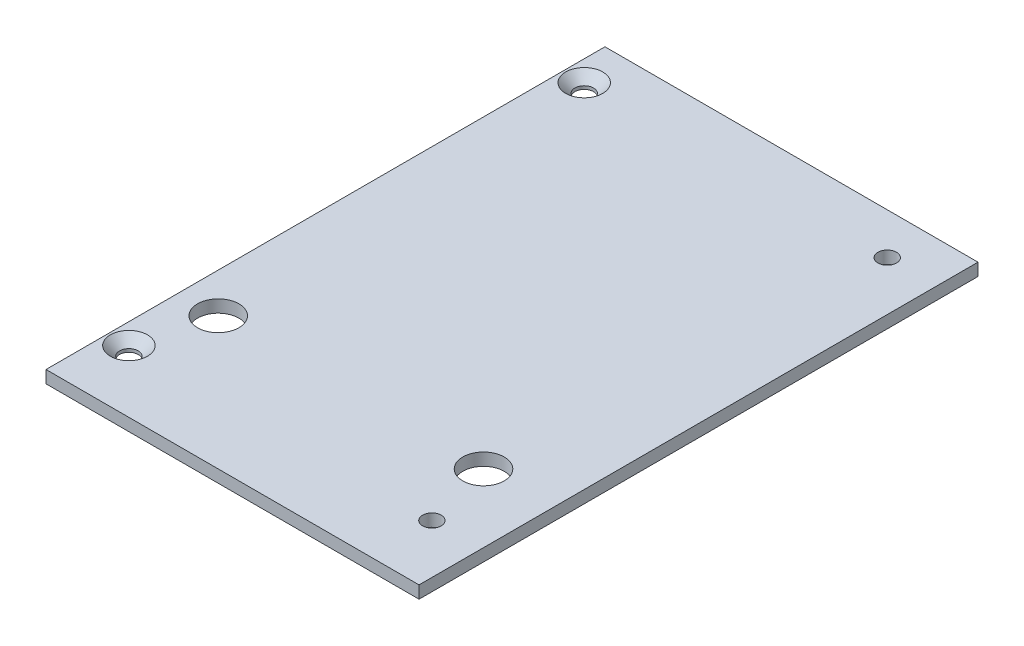
from build123d import *

# Parameters (mm, degrees)
SKETCH1_W                                            = 90
SKETCH1_H                                            = 134.85
SKETCH1_R                                            = 2.25
BOSS_EXTRUDE1_DEPTH                                  = 3
SKETCH2_R                                            = 5
CUT_EXTRUDE1_DEPTH                                   = 10
BOSS_EXTRUDE2_DEPTH                                  = 3
FILLET1_R                                            = 10
AVELLANADO_PARA_TORNILLO_TAP_N_AVELLANAD_D           = 4.5
AVELLANADO_PARA_TORNILLO_TAP_N_AVELLANAD_DEPTH       = 6
AVELLANADO_PARA_TORNILLO_TAP_N_AVELLANAD_CSINK_D     = 8.96
AVELLANADO_PARA_TORNILLO_TAP_N_AVELLANAD_CSINK_ANGLE = 90
AVELLANADO_PARA_TORNILLO_TAP_N_AVELLANAD_TIP         = 1.351936393


with BuildPart() as part:
    # Sketch1 → Boss-Extrude1 (new body)
    with BuildSketch(Plane(origin=(0, 0, 0), x_dir=(1, 0, 0), z_dir=(0, 1, 0))):
        Rectangle(SKETCH1_W, SKETCH1_H)
        with Locations(Location((-40, 57.425, 0), (0, 0, 270))):
            Circle(SKETCH1_R, mode=Mode.SUBTRACT)
        with Locations(Location((33.1, 57.425, 0), (0, 0, 270))):
            Circle(SKETCH1_R, mode=Mode.SUBTRACT)
        with Locations(Location((33.1, -52.425, 0), (0, 0, 270))):
            Circle(SKETCH1_R, mode=Mode.SUBTRACT)
        with Locations(Location((-40, -52.425, 0), (0, 0, 270))):
            Circle(SKETCH1_R, mode=Mode.SUBTRACT)
    extrude(amount=BOSS_EXTRUDE1_DEPTH)

    # Sketch2 → Cut-Extrude1 (cut)
    with BuildSketch(Plane.XZ):
        with Locations(Location((-35.45, 35.425, 0), (0, 0, 270))):
            Circle(SKETCH2_R)
        with Locations(Location((28.55, 35.425, 0), (0, 0, 270))):
            Circle(SKETCH2_R)
    extrude(amount=-CUT_EXTRUDE1_DEPTH, mode=Mode.SUBTRACT)

    # Sketch3 → Boss-Extrude2 (add)
    with BuildSketch(Plane.XZ):
        with BuildLine():
            Line((-34.6, -0.380630602), (-34.6, -67.025))
            Line((-34.6, -67.025), (27.7, -67.025))
            Line((27.7, -67.025), (27.7, -0.380630602))
            ThreePointArc((27.7, -0.380630602), (27.519005613, 0.897019347), (26.990265482, 2.074126918))
            Line((26.990265482, 2.074126918), (0.440265482, 44.150196648))
            ThreePointArc((0.440265482, 44.150196648), (-3.45, 46.295439129), (-7.340265482, 44.150196648))
            Line((-7.340265482, 44.150196648), (-33.890265482, 2.074126918))
            ThreePointArc((-33.890265482, 2.074126918), (-34.419005613, 0.897019347), (-34.6, -0.380630602))
        make_face()
        Polygon((-29.6, -0.49628105), (-29.6, -62.025), (22.7, -62.025), (22.7, -0.49628105), (-3.45, 40.945874259), align=None, mode=Mode.SUBTRACT)
    extrude(amount=BOSS_EXTRUDE2_DEPTH)

    # Fillet1
    # the kernel refuses this fillet: 10 mm, written as the material it adds along each edge
    with BuildSketch(Plane(origin=(32.227432138, 0, -15.595222631), x_dir=(0, -1, 0), z_dir=(-0.5336429389662942, 0, 0.8457098874267795))) as fillet1_piece_1_section:
        with BuildLine():
            CenterArc((10, -7.141428429), FILLET1_R, 134.427004001, 45.572995999)
            Line((0, -7.141428429), (-0.2, -7.141428429))
            Line((-0.2, -7.141428429), (-0.2, 0))
            Line((-0.2, 0), (0, 0.2))
            ThreePointArc((0, 0.2), (1.5, 0.2), (2.86, 0.142828569))
            Line((2.86, 0.142828569), (3, 0))
        make_face()
    fillet1_piece_1 = extrude(amount=84.709945498, mode=Mode.PRIVATE)
    fillet1_piece_1 = split(fillet1_piece_1, bisect_by=Plane(origin=(-18.807365912, 0, 16.607734938), z_dir=(0.8457098874267777, 0, -0.533642938966297)), keep=Keep.TOP, mode=Mode.PRIVATE)
    fillet1_piece_1 = split(fillet1_piece_1, bisect_by=Plane(origin=(22.7, 0, -15.595222631), z_dir=(-1, 0, 0)), keep=Keep.TOP, mode=Mode.PRIVATE)
    add(fillet1_piece_1)
    with BuildSketch(Plane(origin=(22.7, 0, -62.025), x_dir=(0, -1, 0), z_dir=(0, 0, 1))) as fillet1_piece_2_section:
        with BuildLine():
            CenterArc((10, -7.141428429), FILLET1_R, 134.427004001, 45.572995999)
            Line((0, -7.141428429), (-0.2, -7.141428429))
            Line((-0.2, -7.141428429), (-0.2, 0))
            Line((-0.2, 0), (0, 0.2))
            ThreePointArc((0, 0.2), (1.5, 0.2), (2.86, 0.142828569))
            Line((2.86, 0.142828569), (3, 0))
        make_face()
    fillet1_piece_2 = extrude(amount=79.382290022, mode=Mode.PRIVATE)
    fillet1_piece_2 = split(fillet1_piece_2, bisect_by=Plane(origin=(50.468348322, 0, -44.503172209), z_dir=(-0.8457098874267795, 0, -0.5336429389662942)), keep=Keep.TOP, mode=Mode.PRIVATE)
    add(fillet1_piece_2)
    with BuildSketch(Plane(origin=(-29.6, 0, -62.025), x_dir=(0, -1, 0), z_dir=(1, 0, 0))) as fillet1_piece_3:
        with BuildLine():
            CenterArc((10, -7.141428429), FILLET1_R, 134.427004001, 45.572995999)
            Line((0, -7.141428429), (-0.2, -7.141428429))
            Line((-0.2, -7.141428429), (-0.2, 0))
            Line((-0.2, 0), (0, 0.2))
            ThreePointArc((0, 0.2), (1.5, 0.2), (2.86, 0.142828569))
            Line((2.86, 0.142828569), (3, 0))
        make_face()
    extrude(amount=52.3)
    with BuildSketch(Plane(origin=(-29.6, 0, 17.357290022), x_dir=(0, -1, 0), z_dir=(0, 0, -1))) as fillet1_piece_4_section:
        with BuildLine():
            CenterArc((10, -7.141428429), FILLET1_R, 134.427004001, 45.572995999)
            Line((0, -7.141428429), (-0.2, -7.141428429))
            Line((-0.2, -7.141428429), (-0.2, 0))
            Line((-0.2, 0), (0, 0.2))
            ThreePointArc((0, 0.2), (1.5, 0.2), (2.86, 0.142828569))
            Line((2.86, 0.142828569), (3, 0))
        make_face()
    fillet1_piece_4 = extrude(amount=79.382290022, mode=Mode.PRIVATE)
    fillet1_piece_4 = split(fillet1_piece_4, bisect_by=Plane(origin=(-21.542556439, 0, 12.273043135), z_dir=(0.8457098874267777, 0, -0.533642938966297)), keep=Keep.TOP, mode=Mode.PRIVATE)
    add(fillet1_piece_4)
    with BuildSketch(Plane(origin=(6.077432138, 0, 56.04481584), x_dir=(0, -1, 0), z_dir=(-0.5336429389662971, 0, -0.8457098874267778))) as fillet1_piece_5_section:
        with BuildLine():
            CenterArc((10, -7.141428429), FILLET1_R, 134.427004001, 45.572995999)
            Line((0, -7.141428429), (-0.2, -7.141428429))
            Line((-0.2, -7.141428429), (-0.2, 0))
            Line((-0.2, 0), (0, 0.2))
            ThreePointArc((0, 0.2), (1.5, 0.2), (2.86, 0.142828569))
            Line((2.86, 0.142828569), (3, 0))
        make_face()
    fillet1_piece_5 = extrude(amount=84.709945498, mode=Mode.PRIVATE)
    fillet1_piece_5 = split(fillet1_piece_5, bisect_by=Plane(origin=(-7.551087235, 0, 47.445220116), z_dir=(-0.8457098874267795, 0, -0.5336429389662942)), keep=Keep.TOP, mode=Mode.PRIVATE)
    fillet1_piece_5 = split(fillet1_piece_5, bisect_by=Plane(origin=(-29.6, 0, 56.04481584), z_dir=(1, 0, 0)), keep=Keep.TOP, mode=Mode.PRIVATE)
    add(fillet1_piece_5)
    with BuildSketch(Plane(origin=(32.227432138, 0, -15.595222631), x_dir=(0, -1, 0), z_dir=(-0.5336429389662942, 0, 0.8457098874267795))) as fillet1_piece_6a_section:
        with BuildLine():
            CenterArc((10, -7.141428429), FILLET1_R, 134.427004001, 45.572995999)
            Line((0, -7.141428429), (-0.2, -7.141428429))
            Line((-0.2, -7.141428429), (-0.2, 0))
            Line((-0.2, 0), (0, 0.2))
            ThreePointArc((0, 0.2), (1.5, 0.2), (2.86, 0.142828569))
            Line((2.86, 0.142828569), (3, 0))
        make_face()
    fillet1_piece_6a = extrude(amount=84.709945498, mode=Mode.PRIVATE)
    fillet1_piece_6a = split(fillet1_piece_6a, bisect_by=Plane(origin=(22.7, 0, -15.595222631), z_dir=(1, 0, 0)), keep=Keep.TOP, mode=Mode.PRIVATE)
    with BuildSketch(Plane(origin=(22.7, 0, -62.025), x_dir=(0, -1, 0), z_dir=(0, 0, 1))) as fillet1_piece_6b_section:
        with BuildLine():
            CenterArc((10, -7.141428429), FILLET1_R, 134.427004001, 45.572995999)
            Line((0, -7.141428429), (-0.2, -7.141428429))
            Line((-0.2, -7.141428429), (-0.2, 0))
            Line((-0.2, 0), (0, 0.2))
            ThreePointArc((0, 0.2), (1.5, 0.2), (2.86, 0.142828569))
            Line((2.86, 0.142828569), (3, 0))
        make_face()
    fillet1_piece_6b = extrude(amount=79.382290022, mode=Mode.PRIVATE)
    fillet1_piece_6b = split(fillet1_piece_6b, bisect_by=Plane(origin=(50.468348322, 0, -44.503172209), z_dir=(0.8457098874267795, 0, 0.5336429389662942)), keep=Keep.TOP, mode=Mode.PRIVATE)
    fillet1_piece_6 = fillet1_piece_6a & fillet1_piece_6b
    add(fillet1_piece_6)
    with BuildSketch(Plane(origin=(6.077432138, 0, 56.04481584), x_dir=(0, -1, 0), z_dir=(-0.5336429389662971, 0, -0.8457098874267778))) as fillet1_piece_7a_section:
        with BuildLine():
            CenterArc((10, -7.141428429), FILLET1_R, 134.427004001, 45.572995999)
            Line((0, -7.141428429), (-0.2, -7.141428429))
            Line((-0.2, -7.141428429), (-0.2, 0))
            Line((-0.2, 0), (0, 0.2))
            ThreePointArc((0, 0.2), (1.5, 0.2), (2.86, 0.142828569))
            Line((2.86, 0.142828569), (3, 0))
        make_face()
    fillet1_piece_7a = extrude(amount=84.709945498, mode=Mode.PRIVATE)
    fillet1_piece_7a = split(fillet1_piece_7a, bisect_by=Plane(origin=(-7.551087235, 0, 47.445220116), z_dir=(0.8457098874267795, 0, 0.5336429389662942)), keep=Keep.TOP, mode=Mode.PRIVATE)
    with BuildSketch(Plane(origin=(32.227432138, 0, -15.595222631), x_dir=(0, -1, 0), z_dir=(-0.5336429389662942, 0, 0.8457098874267795))) as fillet1_piece_7b_section:
        with BuildLine():
            CenterArc((10, -7.141428429), FILLET1_R, 134.427004001, 45.572995999)
            Line((0, -7.141428429), (-0.2, -7.141428429))
            Line((-0.2, -7.141428429), (-0.2, 0))
            Line((-0.2, 0), (0, 0.2))
            ThreePointArc((0, 0.2), (1.5, 0.2), (2.86, 0.142828569))
            Line((2.86, 0.142828569), (3, 0))
        make_face()
    fillet1_piece_7b = extrude(amount=84.709945498, mode=Mode.PRIVATE)
    fillet1_piece_7b = split(fillet1_piece_7b, bisect_by=Plane(origin=(-18.807365912, 0, 16.607734938), z_dir=(-0.8457098874267777, 0, 0.533642938966297)), keep=Keep.TOP, mode=Mode.PRIVATE)
    fillet1_piece_7 = fillet1_piece_7a & fillet1_piece_7b
    add(fillet1_piece_7)
    with BuildSketch(Plane(origin=(22.7, 0, -79.878571071), x_dir=(0, -1, 0), z_dir=(0, 0, 1))) as fillet1_piece_8a_section:
        with BuildLine():
            CenterArc((10, -7.141428429), FILLET1_R, 134.427004001, 45.572995999)
            Line((0, -7.141428429), (-0.2, -7.141428429))
            Line((-0.2, -7.141428429), (-0.2, 0))
            Line((-0.2, 0), (0, 0.2))
            ThreePointArc((0, 0.2), (1.5, 0.2), (2.86, 0.142828569))
            Line((2.86, 0.142828569), (3, 0))
        make_face()
    fillet1_piece_8a = extrude(amount=97.235861093, mode=Mode.PRIVATE)
    fillet1_piece_8a = split(fillet1_piece_8a, bisect_by=Plane(origin=(22.7, 0, -62.025), z_dir=(0, 0, -1)), keep=Keep.TOP, mode=Mode.PRIVATE)
    with BuildSketch(Plane(origin=(-29.6, 0, -62.025), x_dir=(0, -1, 0), z_dir=(1, 0, 0))) as fillet1_piece_8b_section:
        with BuildLine():
            CenterArc((10, -7.141428429), FILLET1_R, 134.427004001, 45.572995999)
            Line((0, -7.141428429), (-0.2, -7.141428429))
            Line((-0.2, -7.141428429), (-0.2, 0))
            Line((-0.2, 0), (0, 0.2))
            ThreePointArc((0, 0.2), (1.5, 0.2), (2.86, 0.142828569))
            Line((2.86, 0.142828569), (3, 0))
        make_face()
    fillet1_piece_8b = extrude(amount=70.153571071, mode=Mode.PRIVATE)
    fillet1_piece_8b = split(fillet1_piece_8b, bisect_by=Plane(origin=(22.7, 0, -62.025), z_dir=(1, 0, 0)), keep=Keep.TOP, mode=Mode.PRIVATE)
    fillet1_piece_8 = fillet1_piece_8a & fillet1_piece_8b
    add(fillet1_piece_8)
    with BuildSketch(Plane(origin=(-47.453571071, 0, -62.025), x_dir=(0, -1, 0), z_dir=(1, 0, 0))) as fillet1_piece_9a_section:
        with BuildLine():
            CenterArc((10, -7.141428429), FILLET1_R, 134.427004001, 45.572995999)
            Line((0, -7.141428429), (-0.2, -7.141428429))
            Line((-0.2, -7.141428429), (-0.2, 0))
            Line((-0.2, 0), (0, 0.2))
            ThreePointArc((0, 0.2), (1.5, 0.2), (2.86, 0.142828569))
            Line((2.86, 0.142828569), (3, 0))
        make_face()
    fillet1_piece_9a = extrude(amount=70.153571071, mode=Mode.PRIVATE)
    fillet1_piece_9a = split(fillet1_piece_9a, bisect_by=Plane(origin=(-29.6, 0, -62.025), z_dir=(-1, 0, 0)), keep=Keep.TOP, mode=Mode.PRIVATE)
    with BuildSketch(Plane(origin=(-29.6, 0, 17.357290022), x_dir=(0, -1, 0), z_dir=(0, 0, -1))) as fillet1_piece_9b_section:
        with BuildLine():
            CenterArc((10, -7.141428429), FILLET1_R, 134.427004001, 45.572995999)
            Line((0, -7.141428429), (-0.2, -7.141428429))
            Line((-0.2, -7.141428429), (-0.2, 0))
            Line((-0.2, 0), (0, 0.2))
            ThreePointArc((0, 0.2), (1.5, 0.2), (2.86, 0.142828569))
            Line((2.86, 0.142828569), (3, 0))
        make_face()
    fillet1_piece_9b = extrude(amount=97.235861093, mode=Mode.PRIVATE)
    fillet1_piece_9b = split(fillet1_piece_9b, bisect_by=Plane(origin=(-29.6, 0, -62.025), z_dir=(0, 0, -1)), keep=Keep.TOP, mode=Mode.PRIVATE)
    fillet1_piece_9 = fillet1_piece_9a & fillet1_piece_9b
    add(fillet1_piece_9)
    with BuildSketch(Plane(origin=(6.077432138, 0, 56.04481584), x_dir=(0, -1, 0), z_dir=(-0.5336429389662971, 0, -0.8457098874267778))) as fillet1_piece_10a_section:
        with BuildLine():
            CenterArc((10, -7.141428429), FILLET1_R, 134.427004001, 45.572995999)
            Line((0, -7.141428429), (-0.2, -7.141428429))
            Line((-0.2, -7.141428429), (-0.2, 0))
            Line((-0.2, 0), (0, 0.2))
            ThreePointArc((0, 0.2), (1.5, 0.2), (2.86, 0.142828569))
            Line((2.86, 0.142828569), (3, 0))
        make_face()
    fillet1_piece_10a = extrude(amount=84.709945498, mode=Mode.PRIVATE)
    fillet1_piece_10a = split(fillet1_piece_10a, bisect_by=Plane(origin=(-29.6, 0, 56.04481584), z_dir=(-1, 0, 0)), keep=Keep.TOP, mode=Mode.PRIVATE)
    with BuildSketch(Plane(origin=(-29.6, 0, 17.357290022), x_dir=(0, -1, 0), z_dir=(0, 0, -1))) as fillet1_piece_10b_section:
        with BuildLine():
            CenterArc((10, -7.141428429), FILLET1_R, 134.427004001, 45.572995999)
            Line((0, -7.141428429), (-0.2, -7.141428429))
            Line((-0.2, -7.141428429), (-0.2, 0))
            Line((-0.2, 0), (0, 0.2))
            ThreePointArc((0, 0.2), (1.5, 0.2), (2.86, 0.142828569))
            Line((2.86, 0.142828569), (3, 0))
        make_face()
    fillet1_piece_10b = extrude(amount=79.382290022, mode=Mode.PRIVATE)
    fillet1_piece_10b = split(fillet1_piece_10b, bisect_by=Plane(origin=(-21.542556439, 0, 12.273043135), z_dir=(-0.8457098874267777, 0, 0.533642938966297)), keep=Keep.TOP, mode=Mode.PRIVATE)
    fillet1_piece_10 = fillet1_piece_10a & fillet1_piece_10b
    add(fillet1_piece_10)

    # Avellanado para tornillo tapón avellanado de clavija hexagonal de M41
    with Locations(Plane(origin=(-40, 3, 52.425), x_dir=(0, 0, 1), z_dir=(0, 1, 0))):
        with Locations((0, 0), (-109.85, 0)):
            CounterSinkHole(AVELLANADO_PARA_TORNILLO_TAP_N_AVELLANAD_D / 2, AVELLANADO_PARA_TORNILLO_TAP_N_AVELLANAD_CSINK_D / 2, depth=AVELLANADO_PARA_TORNILLO_TAP_N_AVELLANAD_DEPTH, counter_sink_angle=AVELLANADO_PARA_TORNILLO_TAP_N_AVELLANAD_CSINK_ANGLE)
            with Locations((0, 0, -(AVELLANADO_PARA_TORNILLO_TAP_N_AVELLANAD_DEPTH + AVELLANADO_PARA_TORNILLO_TAP_N_AVELLANAD_TIP / 2))):  # 118° drill point
                Cone(0, AVELLANADO_PARA_TORNILLO_TAP_N_AVELLANAD_D / 2, AVELLANADO_PARA_TORNILLO_TAP_N_AVELLANAD_TIP, mode=Mode.SUBTRACT)


solid = part.part
